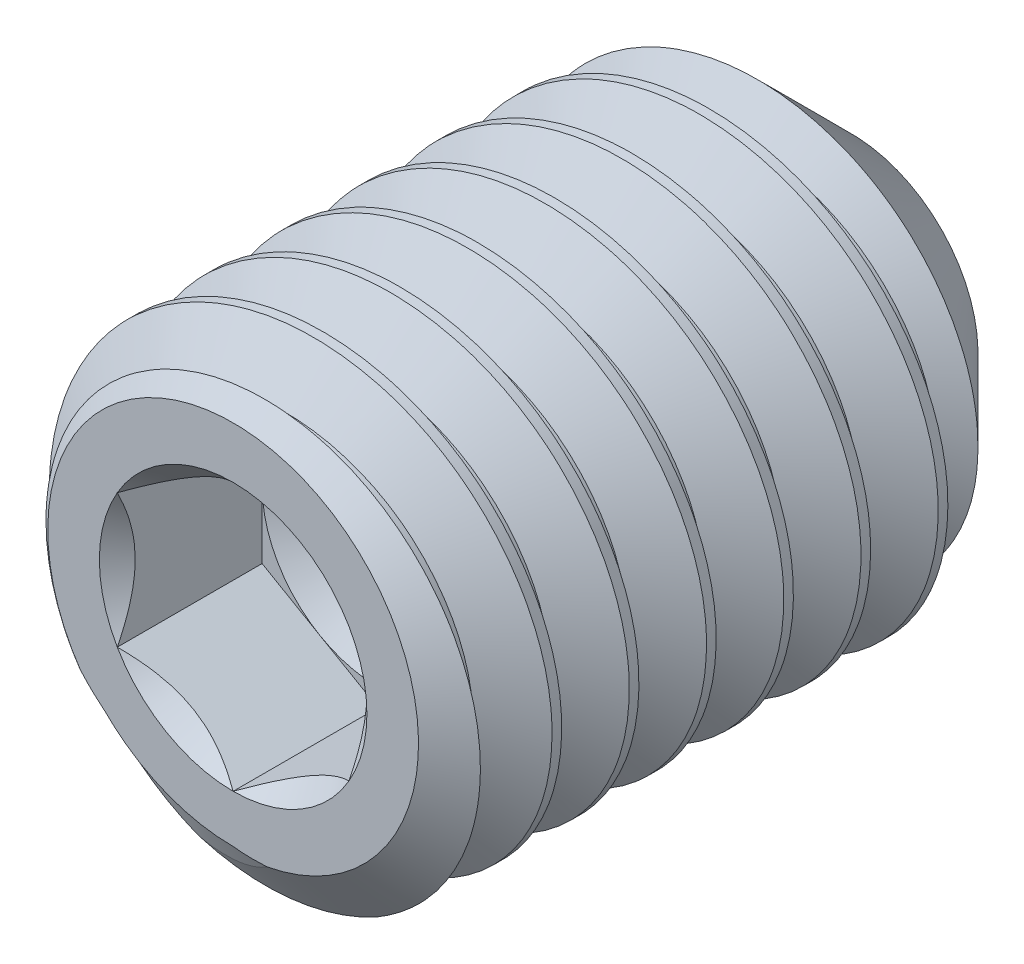
from build123d import *

# Parameters (mm, degrees)
CUT_SWEEP2_PITCH    = 1.5875
CUT_EXTRUDE10_DEPTH = 2.9765625


with BuildPart() as part:
    # Sketch22 → Revolve1 (revolve)
    with BuildSketch(Plane(origin=(0, 0, 0), x_dir=(0, 0, -1), z_dir=(1, 0, 0)), mode=Mode.PRIVATE) as revolve1_sk:
        Polygon((-5.565972169, 0), (-5.565972169, 3.81), (-4.899024489, 4.7625), (4.981210697, 4.7625), (7.134027831, 2.609682866), (7.134027831, 0), (5.565972169, 0), align=None)
    revolve(revolve1_sk.sketch.rotate(Axis((0, 0, -5.565972169), (0, 0, -1)), 180), axis=Axis((0, 0, -5.565972169), (0, 0, -1)))

    # Cut-Sweep2: the profile of Sketch28 profile screwed along a right-hand helix of 9 turns, 8 arcs to a turn; built about Z, then put on its axis
    cut_sweep2_z = Axis((0, 0, 0), (0, 0, 1))
    cut_sweep2_corners = [(4.7628, 0, 0.000173205), (4.7628, 0, -1.389235705), (3.731388504, 0, -0.79375), (3.731388504, 0, -0.5953125)]
    with BuildLine(mode=Mode.PRIVATE) as cut_sweep2_profile:
        Line(cut_sweep2_corners[0], cut_sweep2_corners[1])
        Line(cut_sweep2_corners[1], cut_sweep2_corners[2])
        Line(cut_sweep2_corners[2], cut_sweep2_corners[3])
        Line(cut_sweep2_corners[3], cut_sweep2_corners[0])
    cut_sweep2_cap = Face(cut_sweep2_profile.wire())
    cut_sweep2_turn_angles = [0, 22.5, 45, 67.5, 90, 112.5, 135, 157.5, 180, 202.5, 225, 247.5, 270, 292.5, 315, 337.5, 360]
    cut_sweep2_turn_weights = [1, 0.9238795325112867, 1, 0.9238795325112867, 1, 0.9238795325112867, 1, 0.9238795325112867, 1, 0.9238795325112867, 1, 0.9238795325112867, 1, 0.9238795325112867, 1, 0.9238795325112867, 1]
    cut_sweep2_turn_rails = [Edge.make_bspline([Vector(p[0], p[1], 0).rotate(cut_sweep2_z, cut_sweep2_turn_angles[k]) / cut_sweep2_turn_weights[k] + Vector(0, 0, p[2] + CUT_SWEEP2_PITCH * cut_sweep2_turn_angles[k] / 360) for k in range(17)], [0, 0, 0, 1, 1, 2, 2, 3, 3, 4, 4, 5, 5, 6, 6, 7, 7, 8, 8, 8], 2, cut_sweep2_turn_weights) for p in cut_sweep2_corners]
    cut_sweep2_turn_sides = [Face.make_surface_from_curves(cut_sweep2_turn_rails[p[0]], cut_sweep2_turn_rails[p[1]]) for p in [(0, 1), (1, 2), (2, 3), (3, 0)]]
    cut_sweep2 = Plane(origin=(0, 0, -7.134027831), x_dir=(0, 1, 0), z_dir=(0, 0, 1)) * Solid(Shell([*[p.moved(Location((0, 0, CUT_SWEEP2_PITCH * i))) for i in range(9) for p in cut_sweep2_turn_sides], cut_sweep2_cap, cut_sweep2_cap.rotate(cut_sweep2_z, 3240).moved(Location((0, 0, CUT_SWEEP2_PITCH * 3240 / 360)))]))
    add(cut_sweep2, mode=Mode.SUBTRACT)

    # Sketch23 → Cut-Extrude10 (cut)
    with BuildSketch(Plane.XY.offset(5.565972169)):
        Polygon((0, 2.749630657), (-2.38125, 1.374815329), (-2.38125, -1.374815329), (0, -2.749630657), (2.38125, -1.374815329), (2.38125, 1.374815329), align=None)
    extrude(amount=-CUT_EXTRUDE10_DEPTH, mode=Mode.SUBTRACT)

    # Cut-Extrude11 cone 1 section (through the dimple's axis) → Cut-Extrude11 (revolve, cut)
    with BuildSketch(Plane(origin=(0, 0, 5.565972169), x_dir=(0, -1, 0), z_dir=(1, 0, 0))):
        Polygon((0, 0), (2.749630657, 0), (0, 2.749630657), align=None)
    revolve(axis=Axis((0, 0, 5.565972169), (0, 0, -1)), mode=Mode.SUBTRACT)

    # Cut-Extrude12 cone 1 section (through the dimple's axis) → Cut-Extrude12 (revolve, cut)
    with BuildSketch(Plane(origin=(0, 0, 2.589409669), x_dir=(0, -1, 0), z_dir=(1, 0, 0))):
        Polygon((0, 0), (2.38125, 0), (0, 1.374815329), align=None)
    revolve(axis=Axis((0, 0, 2.589409669), (0, 0, -1)), mode=Mode.SUBTRACT)


solid = part.part
